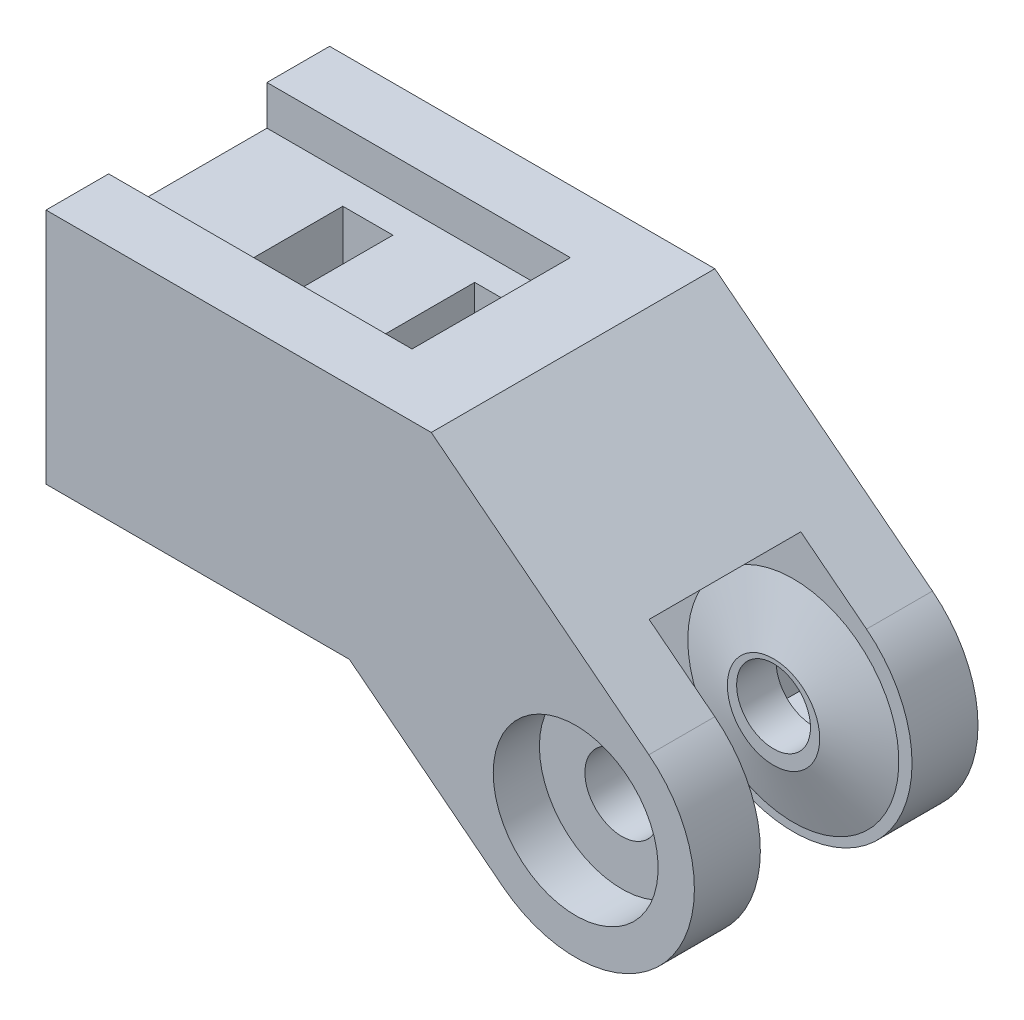
from build123d import *

# Parameters (mm, degrees)
BOSS_EXTRUDE1_DEPTH = 5
SKETCH8_R           = 3.5
BOSS_EXTRUDE5_DEPTH = 1.5
SKETCH10_R          = 8
BOSS_EXTRUDE7_DEPTH = 5.75
SKETCH15_R          = 2.8
CUT_EXTRUDE7_DEPTH  = 10
NUT_CUT_START       = -1.5
SKETCH6_W           = 8.4
SKETCH6_H           = 8.4
NUT_CUT_DEPTH       = 46.182751545
SKETCH16_W          = 12
SKETCH16_H          = 3
CUT_EXTRUDE8_DEPTH  = 23
SKETCH17_R          = 2.35
CUT_EXTRUDE9_DEPTH  = 28
CUT_EXTRUDE10_START = 1.5
SKETCH19_R          = 6.25
CUT_EXTRUDE10_DEPTH = 46.182751545
CUT_EXTRUDE11_START = -8
SKETCH20_R          = 2.35
CUT_EXTRUDE11_DEPTH = 3.8
LPATTERN1_COUNT     = 2
LPATTERN1_PITCH     = 10


with BuildPart() as part:
    # Sketch1 → Boss-Extrude1 (new body)
    with BuildSketch(Plane.XY):
        with BuildLine():
            Line((-40.155138696, -0.836255417), (-17.155138696, -0.836255417))
            Line((-17.155138696, -0.836255417), (-5.547811002, -9.922989015))
            ThreePointArc((-5.547811002, -9.922989015), (7.086733598, -8.384066419), (5.547811002, 4.250478181))
            Line((5.547811002, 4.250478181), (-10.947501986, 17.163744583))
            Line((-10.947501986, 17.163744583), (-40.155138696, 17.163744583))
            Line((-40.155138696, 17.163744583), (-40.155138696, -0.836255417))
        make_face()
    extrude(amount=BOSS_EXTRUDE1_DEPTH)

    # Sketch8 → Boss-Extrude5 (add)
    with BuildSketch(Plane.XY.offset(5)):
        with Locations((0, -3.216528208)):
            Circle(SKETCH8_R)
    extrude(amount=BOSS_EXTRUDE5_DEPTH)

    # Sketch10 → section 0 of loft4
    with BuildSketch(Plane.XY.offset(5), mode=Mode.PRIVATE) as loft4_s0:
        with Locations((0, -3.216528208)):
            Circle(SKETCH10_R)
    # loft up to a face of the part (loft4)
    loft([loft4_s0.sketch, part.faces().sort_by_distance((0, -3.216528208, 6.5))[0]])

    # Sketch14 → Boss-Extrude7 (add)
    with BuildSketch(Plane.XY.offset(5)):
        with BuildLine():
            Line((-40.155138696, -0.836255417), (-40.155138696, 17.163744583))
            Line((-40.155138696, 17.163744583), (-10.947501986, 17.163744583))
            Line((-10.947501986, 17.163744583), (0.567762259, 8.149082357))
            ThreePointArc((0.567762259, 8.149082357), (-8.661563286, 3.944402474), (-10.527859744, -6.024384839))
            Line((-10.527859744, -6.024384839), (-17.155138696, -0.836255417))
            Line((-17.155138696, -0.836255417), (-40.155138696, -0.836255417))
        make_face()
    extrude(amount=BOSS_EXTRUDE7_DEPTH)

    # Sketch15 → Cut-Extrude7 (cut)
    with BuildSketch(Plane(origin=(0, 0, 0), x_dir=(-1, 0, 0), z_dir=(0, 0, -1))):
        with Locations((0, -2.836255417)):
            Circle(SKETCH15_R)
    extrude(amount=-CUT_EXTRUDE7_DEPTH, mode=Mode.SUBTRACT)

    # Mirror1: part across plane


with BuildPart() as part_1:
    add(part.part)
    add(part.part.mirror(Plane(origin=(0, -2.836255417, 10.75), x_dir=(1, 0, 0), z_dir=(0, 0, 1))))

    # Sketch6 → nut-cut (cut, through all)
    with BuildSketch(Plane.XY.offset(5).offset(NUT_CUT_START)):
        with Locations((0, -2.836255417)):
            Rectangle(SKETCH6_W, SKETCH6_H)
    extrude(amount=-NUT_CUT_DEPTH, mode=Mode.SUBTRACT)

    # Sketch16 → Cut-Extrude8 (cut)
    with BuildSketch(Plane.ZY.offset(40.155138696)):
        with Locations((10.75, 0.663744583)):
            Rectangle(SKETCH16_W, SKETCH16_H)
        with Locations((10.75, 15.663744583)):
            Rectangle(SKETCH16_W, SKETCH16_H)
    extrude(amount=-CUT_EXTRUDE8_DEPTH, mode=Mode.SUBTRACT)

    # Sketch17 → Cut-Extrude9 (cut)
    with BuildSketch(Plane.ZY.offset(40.155138696)):
        with Locations((10.75, 8.163744583)):
            Circle(SKETCH17_R)
    extrude(amount=-CUT_EXTRUDE9_DEPTH, mode=Mode.SUBTRACT)

    # Sketch19 → Cut-Extrude10 (cut, through all)
    with BuildSketch(Plane.XY.offset(16.5).offset(CUT_EXTRUDE10_START)):
        with Locations((0, -2.836255417)):
            Circle(SKETCH19_R)
    extrude(amount=CUT_EXTRUDE10_DEPTH, mode=Mode.SUBTRACT)

    # Sketch20 → Cut-Extrude11 (cut)
    with BuildSketch(Plane.ZY.offset(40.155138696).offset(CUT_EXTRUDE11_START)):
        Polygon((14.5, 14.163744583), (7, 14.163744583), (7, 5.998681073), (10.75, 3.833617564), (14.5, 5.998681073), align=None)
        with Locations((10.75, 8.163744583)):
            Circle(SKETCH20_R, mode=Mode.SUBTRACT)
    cut_extrude11 = extrude(amount=-CUT_EXTRUDE11_DEPTH, mode=Mode.SUBTRACT)

    # LPattern1: Cut-Extrude11 ×2
    with Locations(*[(i * LPATTERN1_PITCH, 0, 0) for i in range(1, LPATTERN1_COUNT)]):
        add(cut_extrude11, mode=Mode.SUBTRACT)


solid = part_1.part
